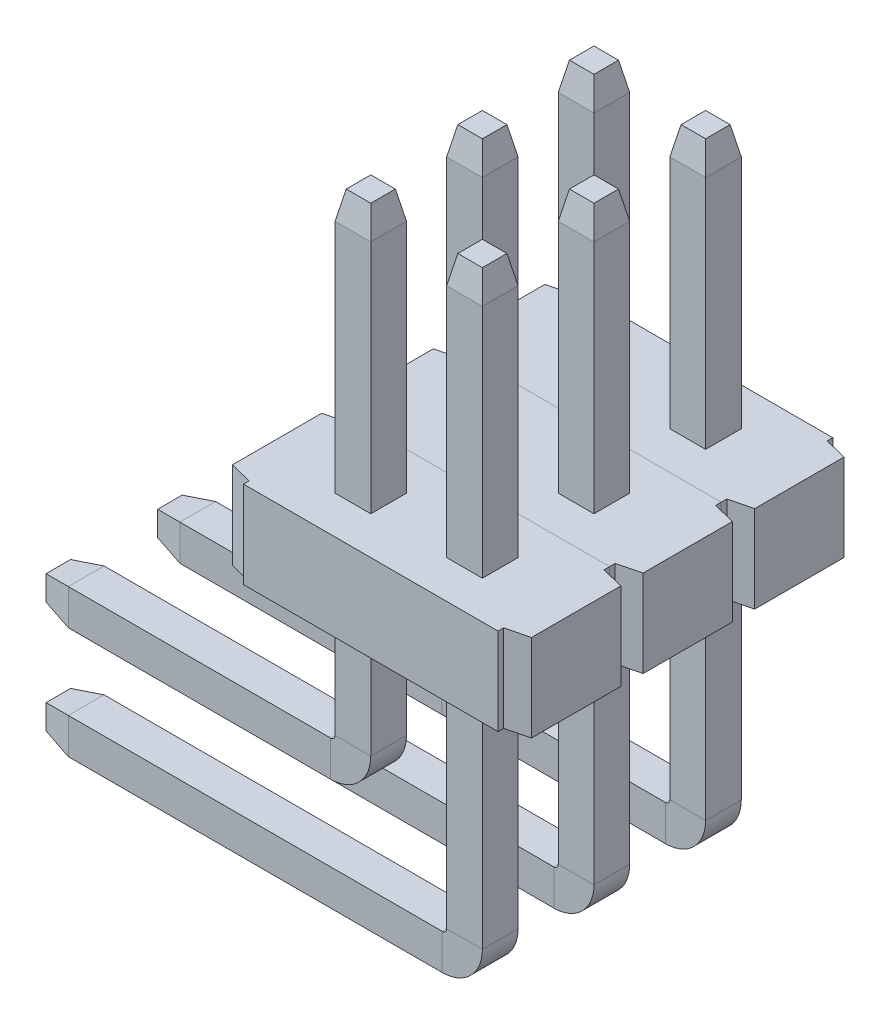
from build123d import *
from OCP.BRepFilletAPI import BRepFilletAPI_MakeChamfer

# Parameters (mm, degrees)
BOSS_EXTRUDE2_DEPTH = 0.9906
SKETCH5_W           = 0.4064
SKETCH5_H           = 0.4064
SKETCH6_W           = 0.4064
SKETCH6_H           = 0.4064
CHAMFER1_SIZE       = 0.0635
CHAMFER1_SIZE2      = 0.3175
CHAMFER2_SIZE       = 0.3175
CHAMFER2_SIZE2      = 0.0635
LPATTERN1_COUNT     = 3
LPATTERN1_PITCH     = 1.27


with BuildPart() as part:
    # Sketch1 → Boss-Extrude2 (new body)
    with BuildSketch(Plane(origin=(0, 0, 0), x_dir=(1, 0, 0), z_dir=(0, 1, 0))):
        Polygon((-1.7018, -0.508), (-1.4478, -0.5715), (-1.4478, -0.635), (1.4478, -0.635), (1.4478, -0.5715), (1.7018, -0.508), (1.7018, 0.508), (1.4478, 0.5715), (1.4478, 0.635), (-1.4478, 0.635), (-1.4478, 0.5715), (-1.7018, 0.508), align=None)
    extrude(amount=BOSS_EXTRUDE2_DEPTH)

    # Sweep5: sweep along a path in Sketch2
    with BuildLine(Plane.XY) as sweep5_path:
        Line((-0.635, 3.9878), (-0.635, 0.9906))
        Line((-0.635, 0.9906), (-0.635, -1.397))
        ThreePointArc((-0.635, -1.397), (-0.709394878, -1.576605122), (-0.889, -1.651))
        Line((-0.889, -1.651), (-4.191, -1.651))
    # Sketch5 → Sweep5 (sweep)
    with BuildSketch(Plane(origin=(0, 3.9878, 0), x_dir=(1, 0, 0), z_dir=(0, 1, 0))):
        with Locations((-0.635, 0)):
            Rectangle(SKETCH5_W, SKETCH5_H)
    sweep(path=sweep5_path.line)

    # Sweep6: sweep along a path in Sketch7
    with BuildLine(Plane.XY) as sweep6_path:
        Line((-4.191, -2.921), (0.381, -2.921))
        ThreePointArc((0.381, -2.921), (0.560605122, -2.846605122), (0.635, -2.667))
        Line((0.635, -2.667), (0.635, 0.9906))
        Line((0.635, 0.9906), (0.635, 3.9878))
    # Sketch6 → Sweep6 (sweep)
    with BuildSketch(Plane(origin=(0, 3.9878, 0), x_dir=(1, 0, 0), z_dir=(0, 1, 0))):
        with Locations((0.635, 0)):
            Rectangle(SKETCH6_W, SKETCH6_H)
    sweep(path=sweep6_path.line)

    # Chamfer1: one chamfer whose edges measure the first distance from different faces: ONE call of the kernel's chamfer builder (chamfer() names one face for all edges)
    chamfer1_edges_1 = [part.edges().sort_by_distance(p)[0] for p in [
        (-4.191, -2.921, -0.2032),
        (-4.191, -2.7178, 0),
        (-4.191, -2.921, 0.2032),
        (-4.191, -3.1242, 0),
    ]]
    chamfer1_side_1 = [part.faces().sort_by_distance(p)[0] for p in [
        (-4.191, -2.921, 0),
    ]]
    chamfer1_edges_2 = [part.edges().sort_by_distance(p)[0] for p in [
        (-0.4318, 3.9878, 0),
        (-0.635, 3.9878, 0.2032),
        (-0.8382, 3.9878, 0),
        (-0.635, 3.9878, -0.2032),
    ]]
    chamfer1_side_2 = [part.faces().sort_by_distance(p)[0] for p in [
        (-0.635, 3.9878, 0),
    ]]
    chamfer1 = BRepFilletAPI_MakeChamfer(part.part.solid().wrapped)
    for e in chamfer1_edges_1:
        chamfer1.Add(CHAMFER1_SIZE, CHAMFER1_SIZE2, e.wrapped, chamfer1_side_1[0].wrapped)  # the first distance lies on this face
    for e in chamfer1_edges_2:
        chamfer1.Add(CHAMFER1_SIZE, CHAMFER1_SIZE2, e.wrapped, chamfer1_side_2[0].wrapped)  # the first distance lies on this face
    add(Compound.cast(chamfer1.Shape()), mode=Mode.REPLACE)

    # Chamfer2: one chamfer whose edges measure the first distance from different faces: ONE call of the kernel's chamfer builder (chamfer() names one face for all edges)
    chamfer2_edges_1 = [part.edges().sort_by_distance(p)[0] for p in [
        (0.635, 3.9878, 0.2032),
    ]]
    chamfer2_side_1 = [part.faces().sort_by_distance(p)[0] for p in [
        (0.635, 2.4892, 0.2032),
    ]]
    chamfer2_edges_2 = [part.edges().sort_by_distance(p)[0] for p in [
        (0.4318, 3.9878, 0),
    ]]
    chamfer2_side_2 = [part.faces().sort_by_distance(p)[0] for p in [
        (0.4318, 2.4892, 0),
    ]]
    chamfer2_edges_3 = [part.edges().sort_by_distance(p)[0] for p in [
        (0.635, 3.9878, -0.2032),
    ]]
    chamfer2_side_3 = [part.faces().sort_by_distance(p)[0] for p in [
        (0.635, 2.4892, -0.2032),
    ]]
    chamfer2_edges_4 = [part.edges().sort_by_distance(p)[0] for p in [
        (0.8382, 3.9878, 0),
    ]]
    chamfer2_side_4 = [part.faces().sort_by_distance(p)[0] for p in [
        (0.8382, 2.4892, 0),
    ]]
    chamfer2_edges_5 = [part.edges().sort_by_distance(p)[0] for p in [
        (-4.191, -1.4478, 0),
    ]]
    chamfer2_side_5 = [part.faces().sort_by_distance(p)[0] for p in [
        (-2.54, -1.4478, 0),
    ]]
    chamfer2_edges_6 = [part.edges().sort_by_distance(p)[0] for p in [
        (-4.191, -1.651, 0.2032),
    ]]
    chamfer2_side_6 = [part.faces().sort_by_distance(p)[0] for p in [
        (-0.635, -0.041916157, 0.2032),
    ]]
    chamfer2_edges_7 = [part.edges().sort_by_distance(p)[0] for p in [
        (-4.191, -1.8542, 0),
    ]]
    chamfer2_side_7 = [part.faces().sort_by_distance(p)[0] for p in [
        (-2.54, -1.8542, 0),
    ]]
    chamfer2_edges_8 = [part.edges().sort_by_distance(p)[0] for p in [
        (-4.191, -1.651, -0.2032),
    ]]
    chamfer2_side_8 = [part.faces().sort_by_distance(p)[0] for p in [
        (-0.473716157, -0.6985, -0.2032),
    ]]
    chamfer2 = BRepFilletAPI_MakeChamfer(part.part.solid().wrapped)
    for e in chamfer2_edges_1:
        chamfer2.Add(CHAMFER2_SIZE, CHAMFER2_SIZE2, e.wrapped, chamfer2_side_1[0].wrapped)  # the first distance lies on this face
    for e in chamfer2_edges_2:
        chamfer2.Add(CHAMFER2_SIZE, CHAMFER2_SIZE2, e.wrapped, chamfer2_side_2[0].wrapped)  # the first distance lies on this face
    for e in chamfer2_edges_3:
        chamfer2.Add(CHAMFER2_SIZE, CHAMFER2_SIZE2, e.wrapped, chamfer2_side_3[0].wrapped)  # the first distance lies on this face
    for e in chamfer2_edges_4:
        chamfer2.Add(CHAMFER2_SIZE, CHAMFER2_SIZE2, e.wrapped, chamfer2_side_4[0].wrapped)  # the first distance lies on this face
    for e in chamfer2_edges_5:
        chamfer2.Add(CHAMFER2_SIZE, CHAMFER2_SIZE2, e.wrapped, chamfer2_side_5[0].wrapped)  # the first distance lies on this face
    for e in chamfer2_edges_6:
        chamfer2.Add(CHAMFER2_SIZE, CHAMFER2_SIZE2, e.wrapped, chamfer2_side_6[0].wrapped)  # the first distance lies on this face
    for e in chamfer2_edges_7:
        chamfer2.Add(CHAMFER2_SIZE, CHAMFER2_SIZE2, e.wrapped, chamfer2_side_7[0].wrapped)  # the first distance lies on this face
    for e in chamfer2_edges_8:
        chamfer2.Add(CHAMFER2_SIZE, CHAMFER2_SIZE2, e.wrapped, chamfer2_side_8[0].wrapped)  # the first distance lies on this face
    add(Compound.cast(chamfer2.Shape()), mode=Mode.REPLACE)


with BuildPart() as lpattern1_1:
    # LPattern1: pattern copy
    add(part.part.moved(Location(Vector(0, 0, -1) * (1 * LPATTERN1_PITCH))))


with BuildPart() as lpattern1_2:
    # LPattern1: pattern copy
    add(part.part.moved(Location(Vector(0, 0, -1) * (2 * LPATTERN1_PITCH))))


solid = Compound([part.part, lpattern1_1.part, lpattern1_2.part])
